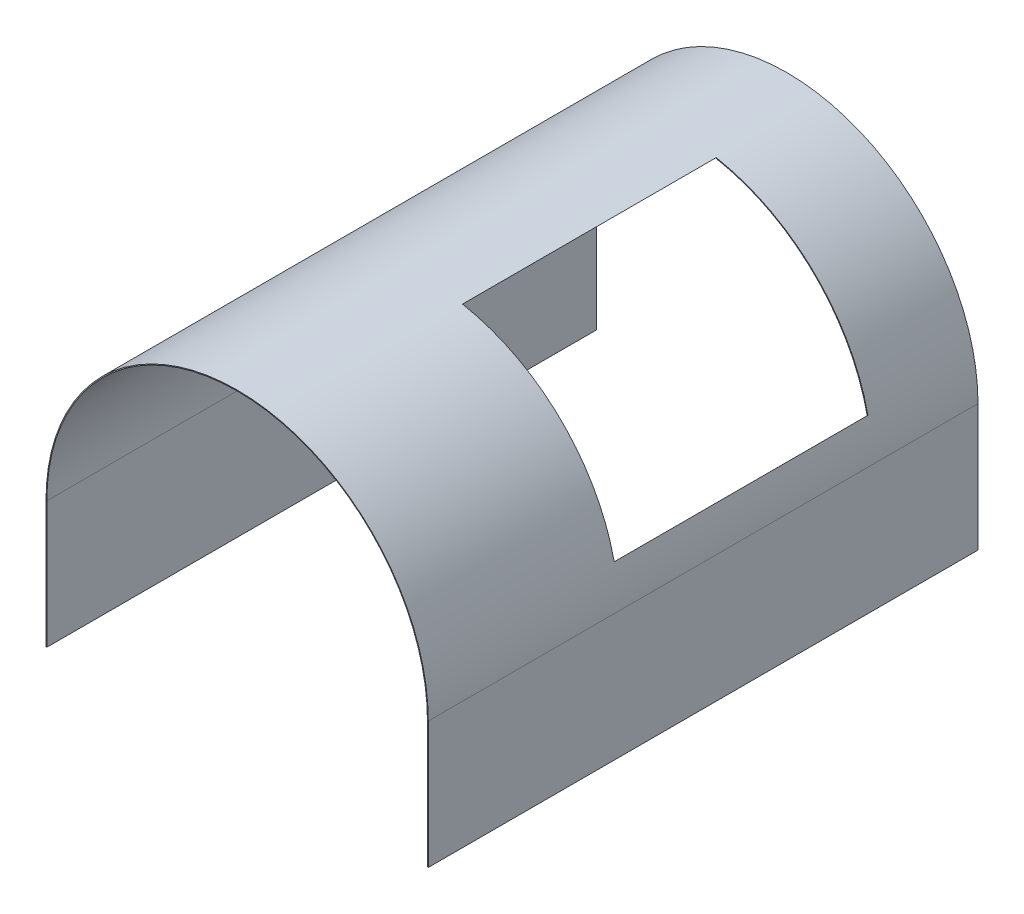
from build123d import *

# Parameters (mm, degrees)
BOSS_EXTRUDE1_DEPTH = 660.4
CUT_EXTRUDE1_DEPTH  = 660.4
SKETCH3_W           = 254
SKETCH3_H           = 304.8
CUT_EXTRUDE2_DEPTH  = 152.4
SKETCH4_W           = 76.2
SKETCH4_H           = 177.8
CUT_EXTRUDE3_DEPTH  = 152.4


with BuildPart() as part:
    # Sketch1 → Boss-Extrude1 (new body)
    with BuildSketch(Plane.XY):
        with BuildLine():
            Line((-228.6, -36.83), (-228.6, -189.23))
            Line((-228.6, -189.23), (230.632, -189.23))
            Line((230.632, -189.23), (230.632, -36.83))
            ThreePointArc((230.632, -36.83), (1.016, 192.786), (-228.6, -36.83))
        make_face()
    extrude(amount=BOSS_EXTRUDE1_DEPTH)

    # Sketch2 → Cut-Extrude1 (cut)
    with BuildSketch(Plane.XY.offset(660.4)):
        with BuildLine():
            Line((-227.584, -36.83), (-227.584, -189.23))
            Line((-227.584, -189.23), (229.616, -189.23))
            Line((229.616, -189.23), (229.616, -36.83))
            ThreePointArc((229.616, -36.83), (1.016, 191.77), (-227.584, -36.83))
        make_face()
    extrude(amount=-CUT_EXTRUDE1_DEPTH, mode=Mode.SUBTRACT)

    # Sketch3 → Cut-Extrude2 (cut)
    with BuildSketch(Plane(origin=(96.389804427, 96.818203557, 0), x_dir=(0.7086729033899728, -0.7055371825785132, 0), z_dir=(0.7055371825785132, 0.7086729033899728, 0))):
        with Locations((24.327583489, -279.4)):
            Rectangle(SKETCH3_W, SKETCH3_H)
    extrude(amount=CUT_EXTRUDE2_DEPTH, mode=Mode.SUBTRACT)

    # Sketch4 → Cut-Extrude3 (cut)
    with BuildSketch(Plane(origin=(-95.378309948, 95.802213548, 0), x_dir=(-0.708672903389973, -0.7055371825785131, 0), z_dir=(0.7055371825785131, -0.708672903389973, 0))):
        with Locations((111.787560149, -279.4)):
            Rectangle(SKETCH4_W, SKETCH4_H)
    extrude(amount=-CUT_EXTRUDE3_DEPTH, mode=Mode.SUBTRACT)


solid = part.part
